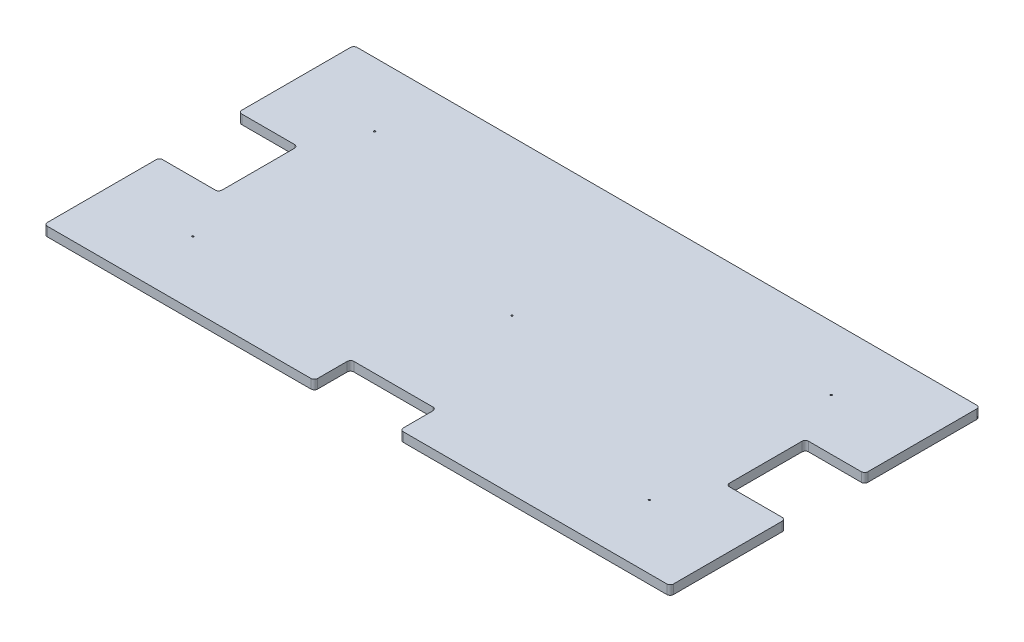
from build123d import *

# Parameters (mm, degrees)
SKETCH1_W                    = 1206.5
SKETCH1_H                    = 596.9
BOSS_EXTRUDE1_DEPTH          = 17.78
FILLET1_R                    = 6.35
SKETCH4_W                    = 165.1
SKETCH4_H                    = 69.85
SKETCH4_W_2                  = 114.3
SKETCH4_H_2                  = 152.4
CUT_EXTRUDE1_DEPTH           = 674.274901805
FILLET2_R                    = 6.35
F_1_8_0_125_DIAMETER_HOLE2_D = 3.175


with BuildPart() as part:
    # Sketch1 → Boss-Extrude1 (new body)
    with BuildSketch(Plane(origin=(0, 0, 0), x_dir=(1, 0, 0), z_dir=(0, 1, 0))):
        Rectangle(SKETCH1_W, SKETCH1_H)
    extrude(amount=BOSS_EXTRUDE1_DEPTH)

    # Fillet1
    fillet1_edges = [part.edges().sort_by_distance(p)[0] for p in [
        (603.25, 8.89, -298.45),
        (603.25, 8.89, 298.45),
        (-603.25, 8.89, 298.45),
        (-603.25, 8.89, -298.45),
    ]]
    fillet(fillet1_edges, radius=FILLET1_R)

    # Sketch4 → Cut-Extrude1 (cut, through all)
    with BuildSketch(Plane(origin=(0, 17.78, 0), x_dir=(1, 0, 0), z_dir=(0, 1, 0))):
        with Locations((0, -263.525)):
            Rectangle(SKETCH4_W, SKETCH4_H)
        with Locations((-546.1, 0)):
            Rectangle(SKETCH4_W_2, SKETCH4_H_2)
        with Locations((546.1, 0)):
            Rectangle(SKETCH4_W_2, SKETCH4_H_2)
    extrude(amount=-CUT_EXTRUDE1_DEPTH, mode=Mode.SUBTRACT)

    # Fillet2
    fillet2_edges = [part.edges().sort_by_distance(p)[0] for p in [
        (82.55, 8.89, 298.45),
        (-82.55, 8.89, 298.45),
        (-82.55, 8.89, 228.6),
        (82.55, 8.89, 228.6),
        (-603.25, 8.89, 76.2),
        (-603.25, 8.89, -76.2),
        (-488.95, 8.89, 76.2),
        (-488.95, 8.89, -76.2),
        (603.25, 8.89, 76.2),
        (488.95, 8.89, 76.2),
        (488.95, 8.89, -76.2),
        (603.25, 8.89, -76.2),
    ]]
    fillet(fillet2_edges, radius=FILLET2_R)

    # 1/8 (0.125) Diameter Hole2 (through all)
    with Locations(Plane(origin=(0, 0, 0), x_dir=(-1, 0, 0), z_dir=(0, -1, 0))):
        with Locations((-439.865615282, 175.258956089), (439.865615282, 175.258956089), (439.865615282, -175.258956089), (0, 0), (-439.865615282, -175.258956089)):
            Hole(F_1_8_0_125_DIAMETER_HOLE2_D / 2)


solid = part.part
